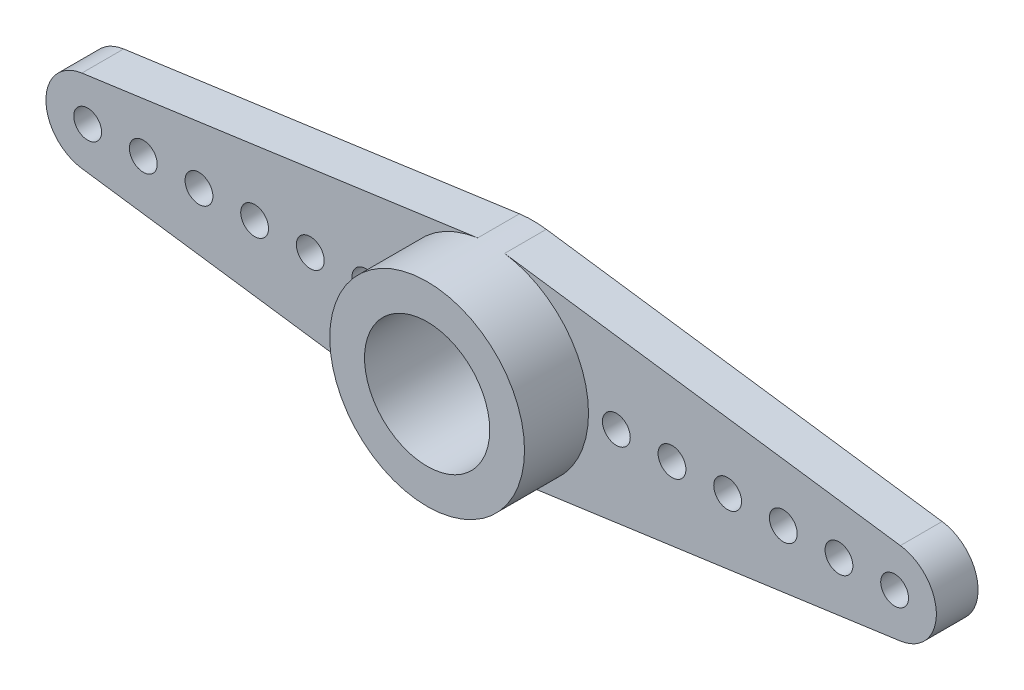
from build123d import *
from build123d.topology import SkipClean

# Parameters (mm, degrees)
EXTRUDE_1_DEPTH     = 1.5
SKETCH_2_R          = 3.5
EXTRUDE_2_DEPTH     = 2.3
SKETCH_3_R          = 2.25
CUT_EXTRUDE_1_DEPTH = 3.8
SKETCH_5_R          = 0.5
CUT_EXTRUDE_2_DEPTH = 1.5


with BuildPart() as part:
    # 草图1 → 凸台-拉伸1 (new body)
    with BuildSketch(Plane.XY):
        with BuildLine():
            Line((-14.706896552, 1.485662753), (-0.482758621, 3.466546425))
            ThreePointArc((-0.482758621, 3.466546425), (0, 3.5), (0.482758621, 3.466546425))
            Line((0.482758621, 3.466546425), (14.706896552, 1.485662753))
            ThreePointArc((14.706896552, 1.485662753), (16, 0), (14.706896552, -1.485662753))
            Line((14.706896552, -1.485662753), (0.482758621, -3.466546425))
            ThreePointArc((0.482758621, -3.466546425), (0, -3.5), (-0.482758621, -3.466546425))
            Line((-0.482758621, -3.466546425), (-14.706896552, -1.485662753))
            ThreePointArc((-14.706896552, -1.485662753), (-16, 0), (-14.706896552, 1.485662753))
        make_face()
    extrude(amount=EXTRUDE_1_DEPTH)

    # 草图2 → 凸台-拉伸2 (add)
    with SkipClean():  # the faces are left unmerged after this step: merging them gives an invalid solid
        with BuildSketch(Plane.XY.offset(1.5)):
            with Locations(Location((0, 0, 0), (0, 0, 97.928141766))):
                Circle(SKETCH_2_R)
        extrude(amount=EXTRUDE_2_DEPTH)
    add(part.part.scale(1), mode=Mode.REPLACE)  # the faces are merged on a copy

    # 草图3 → 切除-拉伸1 (cut)
    with BuildSketch(Plane.XY.offset(3.8)):
        Circle(SKETCH_3_R)
    extrude(amount=-CUT_EXTRUDE_1_DEPTH, mode=Mode.SUBTRACT)

    # 草图5 → 切除-拉伸2 (cut)
    with BuildSketch(Plane(origin=(0, 0, 0), x_dir=(-1, 0, 0), z_dir=(0, 0, -1))):
        with Locations((-4.5, 0)):
            Circle(SKETCH_5_R)
        with Locations((-6.5, 0)):
            Circle(SKETCH_5_R)
        with Locations((-8.5, 0)):
            Circle(SKETCH_5_R)
        with Locations((-10.5, 0)):
            Circle(SKETCH_5_R)
        with Locations((-12.5, 0)):
            Circle(SKETCH_5_R)
        with Locations((-14.5, 0)):
            Circle(SKETCH_5_R)
        with Locations(Location((4.5, 0, 0), (0, 0, 180))):
            Circle(SKETCH_5_R)
        with Locations(Location((14.5, 0, 0), (0, 0, 180))):
            Circle(SKETCH_5_R)
        with Locations(Location((12.5, 0, 0), (0, 0, 180))):
            Circle(SKETCH_5_R)
        with Locations(Location((10.5, 0, 0), (0, 0, 180))):
            Circle(SKETCH_5_R)
        with Locations(Location((8.5, 0, 0), (0, 0, 180))):
            Circle(SKETCH_5_R)
        with Locations(Location((6.5, 0, 0), (0, 0, 180))):
            Circle(SKETCH_5_R)
    extrude(amount=-CUT_EXTRUDE_2_DEPTH, mode=Mode.SUBTRACT)


solid = part.part
